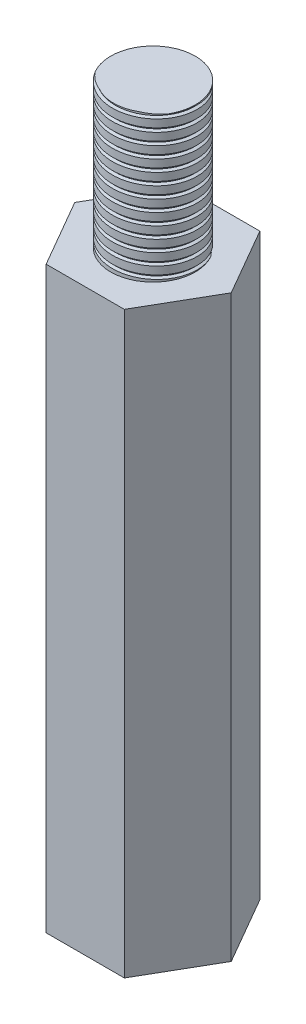
from build123d import *

# Parameters (mm, degrees)
SKETCH_1_R          = 1.46
EXTRUDE_1_DEPTH     = 20
SKETCH_1_3_R        = 1.46
CUT_EXTRUDE_1_DEPTH = 5
SKETCH_2_R          = 1.46
EXTRUDE_2_DEPTH     = 5
SWEEP_1_PITCH       = 0.4
SWEEP_1_FROM        = -0.1
SWEEP_2_PITCH       = 0.4


with BuildPart() as part:
    # 草图1 → 凸台-拉伸1 (new body)
    # profile 1 of 2: a face of its own
    with BuildSketch(Plane(origin=(0, 0, 0), x_dir=(1, 0, 0), z_dir=(0, 1, 0))):
        Polygon((-2.70199926, 0), (-1.35099963, -2.34), (1.35099963, -2.34), (2.70199926, 0), (1.35099963, 2.34), (-1.35099963, 2.34), align=None)
        Circle(SKETCH_1_R, mode=Mode.SUBTRACT)
    # profile 2 of 2: a face of its own
    with BuildSketch(Plane(origin=(0, 0, 0), x_dir=(1, 0, 0), z_dir=(0, 1, 0))):
        Circle(SKETCH_1_R)
    extrude(amount=EXTRUDE_1_DEPTH)

    # 草图1<3> → 切除-拉伸1 (cut)
    with BuildSketch(Plane(origin=(0, 0, 0), x_dir=(1, 0, 0), z_dir=(0, 1, 0))):
        with Locations(Location((0, 0, 0), (0, 0, 270))):
            Circle(SKETCH_1_3_R)
    extrude(amount=CUT_EXTRUDE_1_DEPTH, mode=Mode.SUBTRACT)

    # 切除-扫描2: arcs per turn and ends read off the stored shape
    # 切除-扫描2: the profile of 草图7 profile screwed along a right-hand helix through 23.75 turns, 6 arcs to a turn; built about Z, then put on its axis
    sweep_2_z = Axis((0, 0, 0), (0, 0, 1))
    sweep_2_corners = [(1.4597, 0, 0.1001), (1.66, 0, 0.033333333), (1.66, 0, -0.033333333), (1.4597, 0, -0.1001)]
    with BuildLine(mode=Mode.PRIVATE) as sweep_2_profile:
        Line(sweep_2_corners[0], sweep_2_corners[1])
        Line(sweep_2_corners[1], sweep_2_corners[2])
        Line(sweep_2_corners[2], sweep_2_corners[3])
        Line(sweep_2_corners[3], sweep_2_corners[0])
    sweep_2_cap = Face(sweep_2_profile.wire())
    sweep_2_turn_angles = [0, 30, 60, 90, 120, 150, 180, 210, 240, 270, 300, 330, 360]
    sweep_2_turn_weights = [1, 0.8660254037844387, 1, 0.8660254037844387, 1, 0.8660254037844387, 1, 0.8660254037844387, 1, 0.8660254037844387, 1, 0.8660254037844387, 1]
    sweep_2_turn_rails = [Edge.make_bspline([Vector(p[0], p[1], 0).rotate(sweep_2_z, sweep_2_turn_angles[k]) / sweep_2_turn_weights[k] + Vector(0, 0, p[2] + SWEEP_2_PITCH * sweep_2_turn_angles[k] / 360) for k in range(13)], [0, 0, 0, 1, 1, 2, 2, 3, 3, 4, 4, 5, 5, 6, 6, 6], 2, sweep_2_turn_weights) for p in sweep_2_corners]
    sweep_2_turn_sides = [Face.make_surface_from_curves(sweep_2_turn_rails[p[0]], sweep_2_turn_rails[p[1]]) for p in [(0, 1), (1, 2), (2, 3), (3, 0)]]
    sweep_2_last_angles = [8280, 8310, 8340, 8370, 8400, 8430, 8460, 8490, 8520, 8535, 8550]
    sweep_2_last_weights = [1, 0.8660254037844387, 1, 0.8660254037844387, 1, 0.8660254037844387, 1, 0.8660254037844387, 1, 0.965925826289056, 1]
    sweep_2_last_rails = [Edge.make_bspline([Vector(p[0], p[1], 0).rotate(sweep_2_z, sweep_2_last_angles[k]) / sweep_2_last_weights[k] + Vector(0, 0, p[2] + SWEEP_2_PITCH * sweep_2_last_angles[k] / 360) for k in range(11)], [0, 0, 0, 1, 1, 2, 2, 3, 3, 4, 4, 5, 5, 5], 2, sweep_2_last_weights) for p in sweep_2_corners]
    sweep_2_last_sides = [Face.make_surface_from_curves(sweep_2_last_rails[p[0]], sweep_2_last_rails[p[1]]) for p in [(0, 1), (1, 2), (2, 3), (3, 0)]]
    sweep_2 = Plane(origin=(0, 0, 0), x_dir=(0, 0, -1), z_dir=(0, 1, 0)) * Solid(Shell([*[p.moved(Location((0, 0, SWEEP_2_PITCH * i))) for i in range(23) for p in sweep_2_turn_sides], *sweep_2_last_sides, sweep_2_cap, sweep_2_cap.rotate(sweep_2_z, 8550).moved(Location((0, 0, SWEEP_2_PITCH * 8550 / 360)))]))
    add(sweep_2, mode=Mode.SUBTRACT)


with BuildPart() as body_2:
    # 草图2 → 凸台-拉伸2 (new body)
    with BuildSketch(Plane(origin=(0, 20, 0), x_dir=(1, 0, 0), z_dir=(0, 1, 0))):
        with Locations(Location((0, 0, 0), (0, 0, 270))):
            Circle(SKETCH_2_R)
    extrude(amount=EXTRUDE_2_DEPTH)

    # 切除-扫描1: arcs per turn and ends read off the stored shape
    # 切除-扫描1: the profile of 草图4 screwed along a left-hand helix through 18.75 turns, 6 arcs to a turn; built about Z, then put on its axis
    sweep_1_z = Axis((0, 0, 0), (0, 0, 1))
    sweep_1_corners = [(1.56, 5.45e-07, -0.400000022), (1.56, 5.45e-07, -0.200000022), (1.36, 4.75e-07, -0.266666689), (1.36, 4.75e-07, -0.333333356)]
    with BuildLine(mode=Mode.PRIVATE) as sweep_1_profile:
        Line(sweep_1_corners[0], sweep_1_corners[1])
        Line(sweep_1_corners[1], sweep_1_corners[2])
        Line(sweep_1_corners[2], sweep_1_corners[3])
        Line(sweep_1_corners[3], sweep_1_corners[0])
    sweep_1_cap = Face(sweep_1_profile.wire())
    sweep_1_turn_angles = [0, -30, -60, -90, -120, -150, -180, -210, -240, -270, -300, -330, -360]
    sweep_1_turn_weights = [1, 0.8660254037844387, 1, 0.8660254037844387, 1, 0.8660254037844387, 1, 0.8660254037844387, 1, 0.8660254037844387, 1, 0.8660254037844387, 1]
    sweep_1_turn_rails = [Edge.make_bspline([Vector(p[0], p[1], 0).rotate(sweep_1_z, sweep_1_turn_angles[k]) / sweep_1_turn_weights[k] + Vector(0, 0, p[2] + -SWEEP_1_PITCH * sweep_1_turn_angles[k] / 360) for k in range(13)], [0, 0, 0, 1, 1, 2, 2, 3, 3, 4, 4, 5, 5, 6, 6, 6], 2, sweep_1_turn_weights) for p in sweep_1_corners]
    sweep_1_turn_sides = [Face.make_surface_from_curves(sweep_1_turn_rails[p[0]], sweep_1_turn_rails[p[1]]) for p in [(0, 1), (1, 2), (2, 3), (3, 0)]]
    sweep_1_last_angles = [-6480, -6510, -6540, -6570, -6600, -6630, -6660, -6690, -6720, -6735, -6750]
    sweep_1_last_weights = [1, 0.8660254037844387, 1, 0.8660254037844387, 1, 0.8660254037844387, 1, 0.8660254037844387, 1, 0.9659258262889348, 1]
    sweep_1_last_rails = [Edge.make_bspline([Vector(p[0], p[1], 0).rotate(sweep_1_z, sweep_1_last_angles[k]) / sweep_1_last_weights[k] + Vector(0, 0, p[2] + -SWEEP_1_PITCH * sweep_1_last_angles[k] / 360) for k in range(11)], [0, 0, 0, 1, 1, 2, 2, 3, 3, 4, 4, 5, 5, 5], 2, sweep_1_last_weights) for p in sweep_1_corners]
    sweep_1_last_sides = [Face.make_surface_from_curves(sweep_1_last_rails[p[0]], sweep_1_last_rails[p[1]]) for p in [(0, 1), (1, 2), (2, 3), (3, 0)]]
    sweep_1 = Plane(origin=(0, 20.1, 0), x_dir=(0, 0, 1), z_dir=(0, 1, 0)) * split(Solid(Shell([*[p.moved(Location((0, 0, SWEEP_1_PITCH * i))) for i in range(18) for p in sweep_1_turn_sides], *sweep_1_last_sides, sweep_1_cap, sweep_1_cap.rotate(sweep_1_z, -6750).moved(Location((0, 0, -SWEEP_1_PITCH * -6750 / 360)))])), bisect_by=Plane.XY.offset(SWEEP_1_FROM), keep=Keep.TOP, mode=Mode.PRIVATE)
    add(sweep_1, mode=Mode.SUBTRACT)


solid = Compound([part.part, body_2.part])
